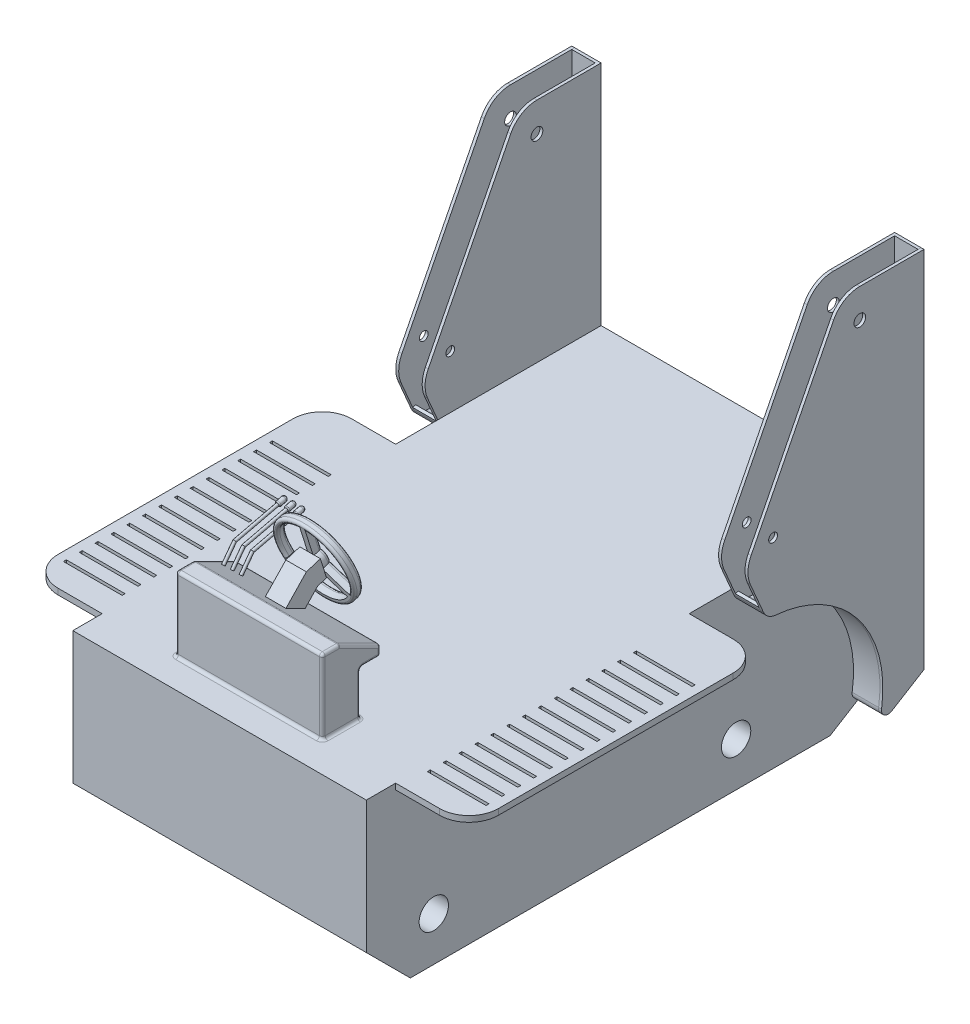
from build123d import *

# Parameters (mm, degrees)
SKETCH1_R            = 50
BOSS_EXTRUDE1_DEPTH  = 500
BOSS_EXTRUDE2_DEPTH  = 10
BOSS_EXTRUDE3_DEPTH  = 80
BOSS_EXTRUDE4_START  = 90
BOSS_EXTRUDE4_DEPTH  = 10
SKETCH11_R           = 20
SKETCH11_R_2         = 15
CUT_EXTRUDE1_DEPTH   = 2051.573090626
BOSS_EXTRUDE5_DEPTH  = 20
SKETCH13_W           = 200
SKETCH13_H           = 10
CUT_EXTRUDE2_DEPTH   = 1428.357698687
LPATTERN1_COUNT      = 14
LPATTERN1_PITCH      = 54
SKETCH14_W           = 500
SKETCH14_H           = 200
BOSS_EXTRUDE6_DEPTH  = 253
SKETCH15_W           = 70
SKETCH15_H           = 150
CUT_EXTRUDE3_DEPTH   = 1941.322138203
FILLET1_R            = 10
SKETCH19_R           = 5
SKETCH20_R           = 8.5
BOSS_EXTRUDE7_DEPTH  = 30
FILLET2_R            = 8.5
FILLET3_R            = 3.5
BOSS_EXTRUDE8_DEPTH  = 35
SKETCH22_R           = 12.5
BOSS_EXTRUDE9_DEPTH  = 15
SKETCH23_R           = 135
BOSS_EXTRUDE10_DEPTH = 15
FILLET4_R            = 9
LPATTERN2_COUNT      = 3
LPATTERN2_PITCH      = 30


with BuildPart() as part:
    # Sketch1 → Boss-Extrude1 (new, symmetric)
    with BuildSketch(Plane(origin=(0, 0, 0), x_dir=(0, 0, -1), z_dir=(1, 0, 0))):
        Polygon((935, 135), (935, 600), (-865, 600), (-865, 150), (-715, 0), (715, 0), align=None)
        with Locations((-635, 150)):
            Circle(SKETCH1_R, mode=Mode.SUBTRACT)
        with Locations((395, 150)):
            Circle(SKETCH1_R, mode=Mode.SUBTRACT)
    extrude(amount=BOSS_EXTRUDE1_DEPTH, both=True)

    # Sketch2 → Boss-Extrude2 (add)
    with BuildSketch(Plane(origin=(500, 0, 0), x_dir=(0, 0, -1), z_dir=(1, 0, 0))):
        with BuildLine():
            Line((935, 135), (935, 1375))
            Line((935, 1375), (716.381652007, 1375))
            ThreePointArc((716.381652007, 1375), (664.068876561, 1360.225427691), (627.214078785, 1320.267470501))
            Line((627.214078785, 1320.267470501), (346.16374438, 766.656323356))
            ThreePointArc((346.16374438, 766.656323356), (335.383915938, 724.631829923), (343.416814601, 681.996922997))
            Line((343.416814601, 681.996922997), (387.712885833, 578.639423456))
            ThreePointArc((387.712885833, 578.639423456), (404.375868705, 557.815691626), (429.373455408, 548.520345231))
            ThreePointArc((429.373455408, 548.520345231), (709.143672785, 397.616140122), (790.525379907, 90.336997652))
            ThreePointArc((790.525379907, 90.336997652), (800.480393681, 67.925179948), (825, 67.5))
            Line((825, 67.5), (935, 135))
        make_face()
    extrude(amount=BOSS_EXTRUDE2_DEPTH)

    # Sketch10 → Boss-Extrude3 (add)
    with BuildSketch(Plane(origin=(510, 0, 0), x_dir=(0, 0, -1), z_dir=(1, 0, 0))):
        with BuildLine():
            Line((387.712885833, 578.639423456), (383.135619431, 589.319711728))
            Line((383.135619431, 589.319711728), (392.327069731, 593.258904714))
            Line((392.327069731, 593.258904714), (396.904336133, 582.578616442))
            ThreePointArc((396.904336133, 582.578616442), (410.234722431, 565.919630977), (430.232791793, 558.483353862))
            ThreePointArc((430.232791793, 558.483353862), (716.997264605, 403.806543625), (800.413514405, 88.845422593))
            ThreePointArc((800.413514405, 88.845422593), (806.002915115, 76.261951326), (819.769837801, 76.023227286))
            Line((819.769837801, 76.023227286), (925, 140.596281363))
            Line((925, 140.596281363), (925, 1375))
            Line((925, 1375), (935, 1375))
            Line((935, 1375), (935, 135))
            Line((935, 135), (825, 67.5))
            ThreePointArc((825, 67.5), (800.480393681, 67.925179948), (790.525379907, 90.336997652))
            ThreePointArc((790.525379907, 90.336997652), (709.143672785, 397.616140122), (429.373455408, 548.520345231))
            ThreePointArc((429.373455408, 548.520345231), (404.375868705, 557.815691626), (387.712885833, 578.639423456))
        make_face()
    extrude(amount=BOSS_EXTRUDE3_DEPTH)


with BuildPart() as body_2:
    # Sketch2<2> → Boss-Extrude4 (new body)
    with BuildSketch(Plane(origin=(500, 0, 0), x_dir=(0, 0, -1), z_dir=(1, 0, 0)).offset(BOSS_EXTRUDE4_START)):
        with BuildLine():
            Line((935, 135), (935, 1375))
            Line((935, 1375), (716.381652007, 1375))
            ThreePointArc((716.381652007, 1375), (664.068876561, 1360.225427691), (627.214078785, 1320.267470501))
            Line((627.214078785, 1320.267470501), (346.16374438, 766.656323356))
            ThreePointArc((346.16374438, 766.656323356), (335.383915938, 724.631829923), (343.416814601, 681.996922997))
            Line((343.416814601, 681.996922997), (387.712885833, 578.639423456))
            ThreePointArc((387.712885833, 578.639423456), (404.375868705, 557.815691626), (429.373455408, 548.520345231))
            ThreePointArc((429.373455408, 548.520345231), (709.143672785, 397.616140122), (790.525379907, 90.336997652))
            ThreePointArc((790.525379907, 90.336997652), (800.480393681, 67.925179948), (825, 67.5))
            Line((825, 67.5), (935, 135))
        make_face()
    extrude(amount=BOSS_EXTRUDE4_DEPTH)


with BuildPart() as body_3:
    # Mirror3: mirrored copy
    add(part.part.mirror(Plane(origin=(0, 0, 0), x_dir=(0, 0, 1), z_dir=(1, 0, 0))))


with BuildPart() as body_4:
    # Mirror3 2: mirrored copy
    add(body_2.part.mirror(Plane(origin=(0, 0, 0), x_dir=(0, 0, 1), z_dir=(1, 0, 0))))


with BuildPart() as cut_extrude1_tool:
    # Sketch11 → Cut-Extrude1 (new, through all)
    with BuildSketch(Plane(origin=(600, 0, 0), x_dir=(0, 0, -1), z_dir=(1, 0, 0))):
        with Locations((716.381652007, 1275)):
            Circle(SKETCH11_R)
        with Locations((420.932004899, 781.388852855)):
            Circle(SKETCH11_R_2)
    extrude(amount=-CUT_EXTRUDE1_DEPTH)


with BuildPart() as part_1:
    add(part.part)

    # Cut-Extrude1: cut by cut_extrude1_tool
    add(cut_extrude1_tool.part, mode=Mode.SUBTRACT)



with BuildPart() as body_2_1:
    add(body_2.part)

    # Cut-Extrude1: cut by cut_extrude1_tool
    add(cut_extrude1_tool.part, mode=Mode.SUBTRACT)


with BuildPart() as body_3_1:
    add(body_3.part)

    # Cut-Extrude1: cut by cut_extrude1_tool
    add(cut_extrude1_tool.part, mode=Mode.SUBTRACT)


with BuildPart() as body_4_1:
    add(body_4.part)

    # Cut-Extrude1: cut by cut_extrude1_tool
    add(cut_extrude1_tool.part, mode=Mode.SUBTRACT)


with BuildPart() as part_2:
    add(part_1.part)

    add(body_3_1.part)  # Boss-Extrude5 merges body 3
    # Sketch12 → Boss-Extrude5 (add)
    with BuildSketch(Plane(origin=(0, 600, 0), x_dir=(1, 0, 0), z_dir=(0, 1, 0))):
        with BuildLine():
            Line((500, 235), (650, 235))
            ThreePointArc((650, 235), (720.710678119, 205.710678119), (750, 135))
            Line((750, 135), (750, -665))
            ThreePointArc((750, -665), (720.710678119, -735.710678119), (650, -765))
            Line((650, -765), (500, -765))
            Line((500, -765), (500, 235))
        make_face()
        with BuildLine():
            Line((-750, 135), (-750, -665))
            ThreePointArc((-750, -665), (-720.710678119, -735.710678119), (-650, -765))
            Line((-650, -765), (-500, -765))
            Line((-500, -765), (-500, 235))
            Line((-500, 235), (-650, 235))
            ThreePointArc((-650, 235), (-720.710678119, 205.710678119), (-750, 135))
        make_face()
    extrude(amount=-BOSS_EXTRUDE5_DEPTH)

    # Sketch13 → Cut-Extrude2 (cut, through all)
    with BuildSketch(Plane(origin=(0, 600, 0), x_dir=(1, 0, 0), z_dir=(0, 1, 0))):
        with Locations((620, 30)):
            Rectangle(SKETCH13_W, SKETCH13_H)
        with Locations((-620, 30)):
            Rectangle(SKETCH13_W, SKETCH13_H)
    cut_extrude2 = extrude(amount=-CUT_EXTRUDE2_DEPTH, mode=Mode.SUBTRACT)

    # LPattern1: Cut-Extrude2 ×14
    with Locations(*[(0, 0, i * LPATTERN1_PITCH) for i in range(1, LPATTERN1_COUNT)]):
        add(cut_extrude2, mode=Mode.SUBTRACT)

    # Sketch14 → Boss-Extrude6 (add)
    with BuildSketch(Plane(origin=(0, 600, 0), x_dir=(1, 0, 0), z_dir=(0, 1, 0))):
        with Locations((0, -665)):
            Rectangle(SKETCH14_W, SKETCH14_H)
    extrude(amount=BOSS_EXTRUDE6_DEPTH)

    # Sketch15 → Cut-Extrude3 (cut, through all)
    with BuildSketch(Plane(origin=(250, 0, 0), x_dir=(0, 0, -1), z_dir=(1, 0, 0))):
        Polygon((-565, 783), (-705, 853), (-565, 853), align=None)
        with Locations((-600, 675)):
            Rectangle(SKETCH15_W, SKETCH15_H)
    extrude(amount=-CUT_EXTRUDE3_DEPTH, mode=Mode.SUBTRACT)

    # Fillet1
    fillet1_edges = [part_2.edges().sort_by_distance(p)[0] for p in [
        (0, 600, 765),
        (-250, 726.5, 765),
        (250, 600, 700),
        (250, 726.5, 765),
        (0, 853, 765),
        (250, 853, 735),
        (-250, 853, 735),
        (0, 853, 705),
        (-250, 766.5, 565),
        (250, 766.5, 565),
        (0, 750, 565),
        (-250, 600, 700),
        (-250, 818, 635),
        (0, 783, 565),
        (250, 818, 635),
        (-250, 675, 635),
        (0, 600, 635),
        (-250, 750, 600),
        (0, 750, 635),
        (250, 750, 600),
        (250, 675, 635),
    ]]
    fillet(fillet1_edges, radius=FILLET1_R)


with BuildPart() as body_4_2:
    # Sweep1: sweep along a path in Sketch18
    with BuildLine(Plane.ZY.offset(220)) as sweep1_path:
        Line((631.659464116, 817.12866552), (593.385723429, 868.73002864))
        Line((593.385723429, 868.73002864), (447.490572802, 903.581212604))
    # Sketch19 → Sweep1 (sweep)
    with BuildSketch(Plane(origin=(-220, 903.581212604, 447.490572802), x_dir=(-1, 0, 0), z_dir=(0, 0.23234122642147303, -0.972634337510745))):
        with Locations((-0.294831941, 0.449903305)):
            Circle(SKETCH19_R)
    sweep(path=sweep1_path.line, transition=Transition.RIGHT)


with BuildPart() as body_5:
    # Sketch20 → Boss-Extrude7 (new body)
    with BuildSketch(Plane(origin=(0, -52.347763093, 219.139894629), x_dir=(-1, 0, 0), z_dir=(0, 0.23234122642147303, -0.972634337510745))):
        with Locations(Location((219.705168059, 983.27452591, 0), (0, 0, 90))):
            Circle(SKETCH20_R)
    extrude(amount=BOSS_EXTRUDE7_DEPTH)

    # Fillet2
    fillet2_edges = [body_5.edges().sort_by_distance(p)[0] for p in [
        (-219.705168059, 902.72164893, 416.441173338),
    ]]
    fillet(fillet2_edges, radius=FILLET2_R)

    # Fillet3
    fillet3_edges = [body_5.edges().sort_by_distance(p)[0] for p in [
        (-219.705168059, 895.751412138, 445.620203463),
    ]]
    fillet(fillet3_edges, radius=FILLET3_R)


with BuildPart() as body_6:
    # Sketch21 → Boss-Extrude8 (new, symmetric)
    with BuildSketch(Plane(origin=(0, 0, 0), x_dir=(0, 0, -1), z_dir=(1, 0, 0))):
        Polygon((-673.823100421, 837.41155021), (-604.143596137, 910.526300314), (-556.425872442, 925.460115816), (-535.518530741, 858.655302643), (-565.959355029, 849.128493348), (-608.332547892, 804.666273946), align=None)
    extrude(amount=BOSS_EXTRUDE8_DEPTH, both=True)


with BuildPart() as body_7:
    # Sketch22 → Boss-Extrude9 (new, symmetric)
    with BuildSketch(Plane(origin=(0, -76.047321813, 242.992495097), x_dir=(-1, 0, 0), z_dir=(0, 0.2986763100264702, -0.9543544738874398))):
        with Locations(Location((0, 1014.408228317, 0), (0, 0, 90))):
            Circle(SKETCH22_R)
    extrude(amount=BOSS_EXTRUDE9_DEPTH, both=True)


with BuildPart() as body_8:
    # Sketch23 → Boss-Extrude10 (new, symmetric)
    with BuildSketch(Plane(origin=(0, -71.567177163, 228.677177989), x_dir=(-1, 0, 0), z_dir=(0, 0.2986763100264702, -0.9543544738874398))):
        with Locations(Location((0, 1014.408228317, 0), (0, 0, 90))):
            Circle(SKETCH23_R)
        with BuildLine():
            Line((-9, 1131.061560889), (-9, 1043.02640436))
            ThreePointArc((-9, 1043.02640436), (-25.980762114, 1029.408228317), (-29.284067463, 1007.89336893))
            Line((-29.284067463, 1007.89336893), (-105.524749443, 963.875790666))
            ThreePointArc((-105.524749443, 963.875790666), (-101.324972243, 1072.908228317), (-9, 1131.061560889))
        make_face(mode=Mode.SUBTRACT)
        with BuildLine():
            Line((9, 1131.061560889), (9, 1043.02640436))
            ThreePointArc((9, 1043.02640436), (25.980762114, 1029.408228317), (29.284067463, 1007.89336893))
            Line((29.284067463, 1007.89336893), (105.524749443, 963.875790666))
            ThreePointArc((105.524749443, 963.875790666), (101.324972243, 1072.908228317), (9, 1131.061560889))
        make_face(mode=Mode.SUBTRACT)
        with BuildLine():
            Line((96.524749443, 948.287333398), (20.284067463, 992.304911662))
            ThreePointArc((20.284067463, 992.304911662), (0, 984.408228317), (-20.284067463, 992.304911662))
            Line((-20.284067463, 992.304911662), (-96.524749443, 948.287333398))
            ThreePointArc((-96.524749443, 948.287333398), (0, 897.408228317), (96.524749443, 948.287333398))
        make_face(mode=Mode.SUBTRACT)
    extrude(amount=BOSS_EXTRUDE10_DEPTH, both=True)

    # Fillet4
    fillet4_edges = [body_8.edges().sort_by_distance(p)[0] for p in [
        (25.980762114, 915.333315639, 521.821712025),
        (9, 970.338255617, 539.036146447),
        (0, 763.219855255, 505.650899738),
        (-101.324972243, 947.887445952, 563.444765728),
        (-101.324972243, 956.847735253, 534.814131511),
        (-9, 970.338255617, 539.036146447),
        (-25.980762114, 915.333315639, 521.821712025),
        (-67.404408453, 873.796326954, 508.822229287),
        (0, 789.358525085, 482.396439102),
        (-58.404408453, 858.919413019, 504.166326391),
        (0, 872.387364314, 508.381278074),
        (58.404408453, 858.919413019, 504.166326391),
        (0, 772.180144556, 477.020265521),
        (101.324972243, 947.887445952, 563.444765728),
        (101.324972243, 956.847735253, 534.814131511),
        (67.404408453, 873.796326954, 508.822229287),
    ]]
    fillet(fillet4_edges, radius=FILLET4_R - 0.0001)  # a hair under: the kernel refuses the full size


with BuildPart() as lpattern2_1:
    # LPattern2: pattern copy
    add(body_5.part.moved(Location(Vector(1, 0, 0) * (1 * LPATTERN2_PITCH))))


with BuildPart() as lpattern2_2:
    # LPattern2: pattern copy
    add(body_5.part.moved(Location(Vector(1, 0, 0) * (2 * LPATTERN2_PITCH))))


with BuildPart() as lpattern2_3:
    # LPattern2: pattern copy
    add(body_4_2.part.moved(Location(Vector(1, 0, 0) * (1 * LPATTERN2_PITCH))))


with BuildPart() as lpattern2_4:
    # LPattern2: pattern copy
    add(body_4_2.part.moved(Location(Vector(1, 0, 0) * (2 * LPATTERN2_PITCH))))


solid = Compound([body_2_1.part, body_4_1.part, part_2.part, body_4_2.part, body_5.part, body_6.part, body_7.part, body_8.part, lpattern2_1.part, lpattern2_2.part, lpattern2_3.part, lpattern2_4.part])
